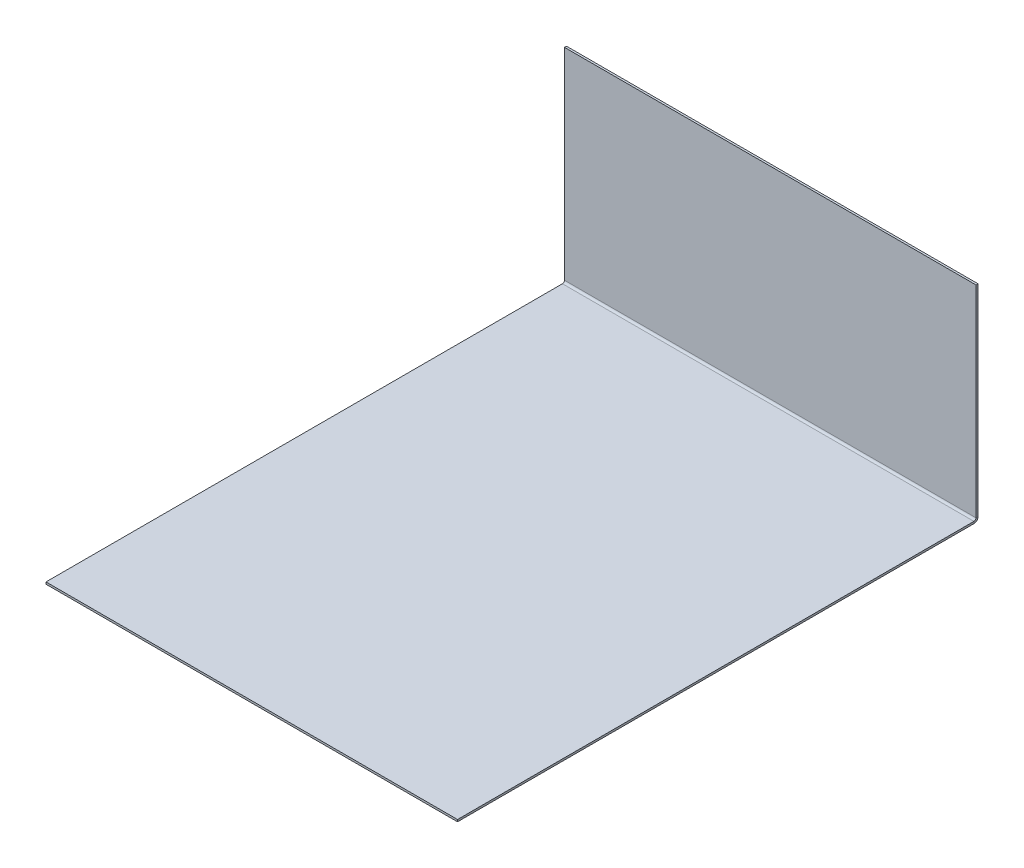
from build123d import *

# Parameters (mm, degrees)
SKETCH1_W          = 203.2
SKETCH1_H          = 254
BASE_FLANGE1_DEPTH = 1
EDGE_FLANGE1_DEPTH = 203.2


# Sheet-metal steps are written as plain solids
with BuildPart() as part:
    # Sketch1 → Base-Flange1 (new body)
    with BuildSketch(Plane(origin=(0, 0, 0), x_dir=(1, 0, 0), z_dir=(0, 1, 0))):
        Rectangle(SKETCH1_W, SKETCH1_H)
    extrude(amount=-BASE_FLANGE1_DEPTH)

    # Edge-Flange1 section (across the edge) → Edge-Flange1 (add)
    with BuildSketch(Plane(origin=(101.6, 0, -130), x_dir=(0, 0, 1), z_dir=(-1, 0, 0))):
        with BuildLine():
            Line((0, 1), (0, 100.6))
            Line((0, 100.6), (1, 100.6))
            Line((1, 100.6), (1, 1))
            ThreePointArc((1, 1), (1.292893219, 0.292893219), (2, 0))
            Line((2, 0), (3, 0))
            Line((3, 0), (3, -1))
            Line((3, -1), (2, -1))
            ThreePointArc((2, -1), (0.585786438, -0.414213562), (0, 1))
        make_face()
    extrude(amount=EDGE_FLANGE1_DEPTH)


solid = part.part
